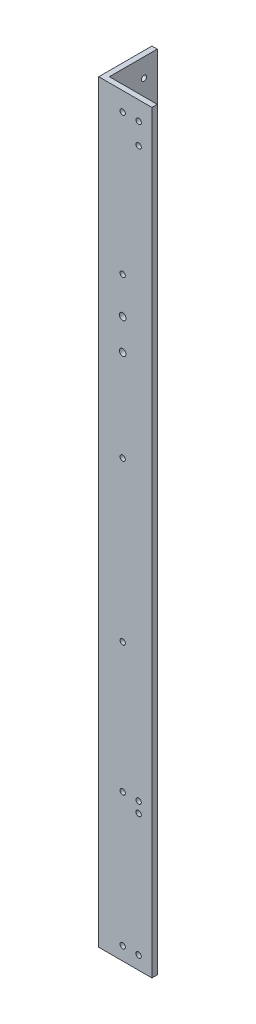
from build123d import *

# Parameters (mm, degrees)
BOSS_EXTRUDE1_DEPTH               = 450
FRONTSIDEHOLES_SKETCH3_R          = 1.5875
FRONTSIDEHOLES_SKETCH3_R_2        = 2
FRONTSIDEHOLES_CUT_EXTRUDE1_DEPTH = 3.175
LEFTSIDEHOLES_SKETCH4_R           = 1.5875
LEFTSIDEHOLES_CUT_EXTRUDE2_DEPTH  = 3.175


with BuildPart() as part:
    # Sketch2 → Boss-Extrude1 (new body)
    with BuildSketch(Plane(origin=(0, 0, 0), x_dir=(1, 0, 0), z_dir=(0, 1, 0))):
        Polygon((0, 31.75), (3.175, 31.75), (3.175, 3.175), (31.75, 3.175), (31.75, 0), (0, 0), align=None)
    extrude(amount=BOSS_EXTRUDE1_DEPTH)

    # FrontSideHoles-Sketch3 → FrontSideHoles-Cut-Extrude1 (cut)
    with BuildSketch(Plane.XY):
        with Locations((23.8125, 81.1125)):
            Circle(FRONTSIDEHOLES_SKETCH3_R)
        with Locations((14.2875, 87.4625)):
            Circle(FRONTSIDEHOLES_SKETCH3_R)
        with Locations((23.8125, 87.4625)):
            Circle(FRONTSIDEHOLES_SKETCH3_R)
        with Locations((14.2875, 438.8875)):
            Circle(FRONTSIDEHOLES_SKETCH3_R)
        with Locations((23.8125, 438.8875)):
            Circle(FRONTSIDEHOLES_SKETCH3_R)
        with Locations((23.8125, 426.1875)):
            Circle(FRONTSIDEHOLES_SKETCH3_R)
        with Locations((14.2875, 333.177644)):
            Circle(FRONTSIDEHOLES_SKETCH3_R_2)
        with Locations((14.2875, 314.652644)):
            Circle(FRONTSIDEHOLES_SKETCH3_R_2)
        with Locations((14.2875, 260)):
            Circle(FRONTSIDEHOLES_SKETCH3_R)
        with Locations((14.2875, 165)):
            Circle(FRONTSIDEHOLES_SKETCH3_R)
        with Locations((14.2875, 355)):
            Circle(FRONTSIDEHOLES_SKETCH3_R)
        with Locations((14.2875, 7.9375)):
            Circle(FRONTSIDEHOLES_SKETCH3_R)
        with Locations((23.8125, 7.9375)):
            Circle(FRONTSIDEHOLES_SKETCH3_R)
    extrude(amount=-FRONTSIDEHOLES_CUT_EXTRUDE1_DEPTH, mode=Mode.SUBTRACT)

    # LeftSideHoles-Sketch4 → LeftSideHoles-Cut-Extrude2 (cut)
    with BuildSketch(Plane.ZY):
        with Locations((-23.8125, 81.1125)):
            Circle(LEFTSIDEHOLES_SKETCH4_R)
        with Locations((-14.2875, 81.1125)):
            Circle(LEFTSIDEHOLES_SKETCH4_R)
        with Locations((-23.8125, 87.4625)):
            Circle(LEFTSIDEHOLES_SKETCH4_R)
        with Locations((-23.8125, 438.8875)):
            Circle(LEFTSIDEHOLES_SKETCH4_R)
        with Locations((-23.8125, 426.1875)):
            Circle(LEFTSIDEHOLES_SKETCH4_R)
        with Locations((-14.2875, 426.1875)):
            Circle(LEFTSIDEHOLES_SKETCH4_R)
        with Locations((-23.8125, 327.602644)):
            Circle(LEFTSIDEHOLES_SKETCH4_R)
        with Locations((-14.2875, 327.602644)):
            Circle(LEFTSIDEHOLES_SKETCH4_R)
        with Locations((-23.8125, 292.677644)):
            Circle(LEFTSIDEHOLES_SKETCH4_R)
        with Locations((-14.2875, 292.677644)):
            Circle(LEFTSIDEHOLES_SKETCH4_R)
        with Locations((-23.8125, 7.9375)):
            Circle(LEFTSIDEHOLES_SKETCH4_R)
        with Locations((-14.2875, 7.9375)):
            Circle(LEFTSIDEHOLES_SKETCH4_R)
        with Locations((-14.2875, 165)):
            Circle(LEFTSIDEHOLES_SKETCH4_R)
        with Locations((-14.2875, 260)):
            Circle(LEFTSIDEHOLES_SKETCH4_R)
        with Locations((-14.2875, 355)):
            Circle(LEFTSIDEHOLES_SKETCH4_R)
    extrude(amount=-LEFTSIDEHOLES_CUT_EXTRUDE2_DEPTH, mode=Mode.SUBTRACT)


solid = part.part
